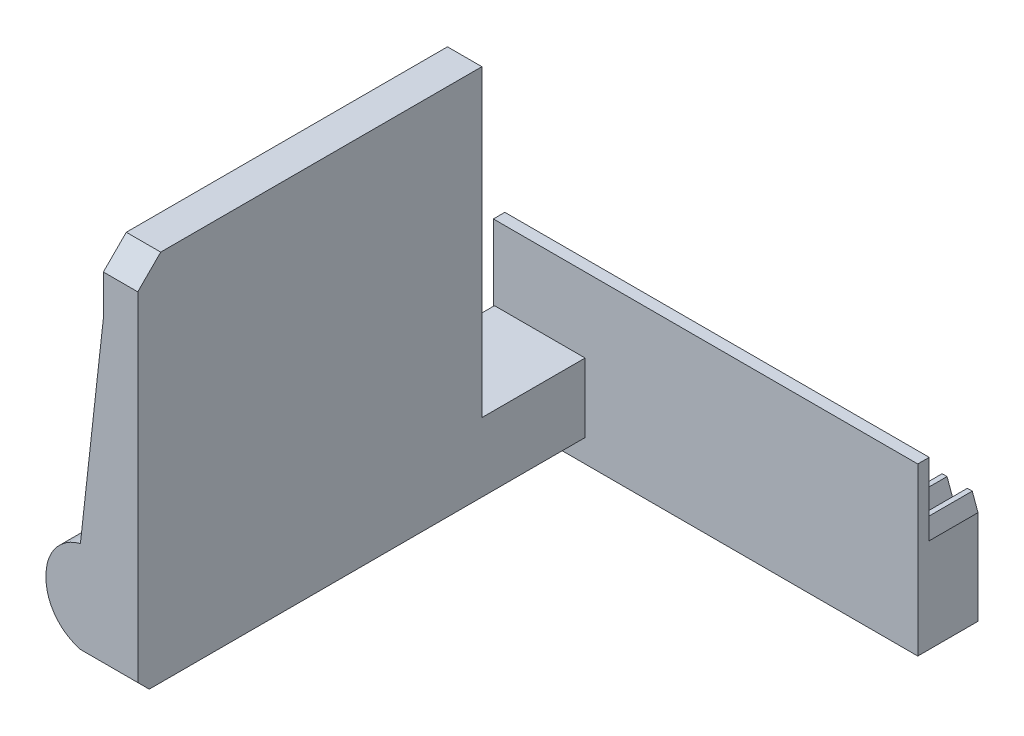
from build123d import *

# Parameters (mm, degrees)
SKETCH1_W           = 37
SKETCH1_H           = 8.005
SKETCH1_H_2         = 6.5
BOSS_EXTRUDE2_DEPTH = 1
BOSS_EXTRUDE3_DEPTH = 39
SKETCH3_W           = 9
SKETCH3_H           = 26.495
CUT_EXTRUDE1_DEPTH  = 65.214183639
SKETCH5_W           = 5
SKETCH5_H           = 5.5
CUT_EXTRUDE2_DEPTH  = 30
FILLET3_R           = 4
CHAMFER1_SIZE       = 2
SKETCH6_W           = 18.033887542
SKETCH6_H           = 50.935114565
CUT_EXTRUDE3_DEPTH  = 1


with BuildPart() as part:
    # <Rack>-<rack spur rectangular_am-5-solid1>: read off the stored shape, not the designer's step
    # <Rack>-<rack spur rectangular_am-5-solid1>: loft between two sections, ruled curve by curve
    rack_rack_spur_rectangular_am_5_solid1_from = [
        Edge.make_line((-44.536254126, 16.385147548, 25.848409668), (-44.964253225, 16.385147548, 25.848409668)),
        Edge.make_line((-46.735368981, 16.385147548, 25.848409668), (-47.16336808, 16.385147548, 25.848409668)),
        Edge.make_line((-48.934483836, 16.385147548, 25.848409668), (-49.362482935, 16.385147548, 25.848409668)),
        Edge.make_line((-51.133598691, 16.385147548, 25.848409668), (-51.56159779, 16.385147548, 25.848409668)),
        Edge.make_line((-53.332713546, 16.385147548, 25.848409668), (-53.760712645, 16.385147548, 25.848409668)),
        Edge.make_line((-55.531828401, 16.385147548, 25.848409668), (-55.9598275, 16.385147548, 25.848409668)),
        Edge.make_line((-57.730943256, 16.385147548, 25.848409668), (-58.158942355, 16.385147548, 25.848409668)),
        Edge.make_line((-59.930058111, 16.385147548, 25.848409668), (-60.35805721, 16.385147548, 25.848409668)),
        Edge.make_line((-62.129172966, 16.385147548, 25.848409668), (-62.557172065, 16.385147548, 25.848409668)),
        Edge.make_line((-64.328287821, 16.385147548, 25.848409668), (-64.75628692, 16.385147548, 25.848409668)),
        Edge.make_line((-66.527402676, 16.385147548, 25.848409668), (-66.955401775, 16.385147548, 25.848409668)),
        Edge.make_line((-68.726517531, 16.385147548, 25.848409668), (-69.15451663, 16.385147548, 25.848409668)),
        Edge.make_line((-70.925632386, 16.385147548, 25.848409668), (-71.353631485, 16.385147548, 25.848409668)),
        Edge.make_line((-73.124747241, 16.385147548, 25.848409668), (-73.55274634, 16.385147548, 25.848409668)),
        Edge.make_line((-75.323862096, 16.385147548, 25.848409668), (-75.751861195, 16.385147548, 25.848409668)),
        Edge.make_line((-77.522976951, 16.385147548, 25.848409668), (-77.95097605, 16.385147548, 25.848409668)),
        Edge.make_line((-78.836533928, 14.810147548, 25.848409668), (-78.836533928, 6.805147548, 25.848409668)),
        Edge.make_line((-42.337139271, 16.385147548, 25.848409668), (-42.76513837, 16.385147548, 25.848409668)),
        Edge.make_line((-41.836533928, 15.009745672, 25.848409668), (-41.836533928, 6.805147548, 25.848409668)),
        Edge.make_line((-78.836533928, 6.805147548, 25.848409668), (-41.836533928, 6.805147548, 25.848409668)),
        Edge.make_line((-77.95097605, 16.385147548, 25.848409668), (-78.524229169, 14.810147548, 25.848409668)),
        Edge.make_line((-78.836533928, 14.810147548, 25.848409668), (-78.524229169, 14.810147548, 25.848409668)),
        Edge.make_line((-77.522976951, 16.385147548, 25.848409668), (-76.949723832, 14.810147548, 25.848409668)),
        Edge.make_line((-75.751861195, 16.385147548, 25.848409668), (-76.325114314, 14.810147548, 25.848409668)),
        Edge.make_line((-76.949723832, 14.810147548, 25.848409668), (-76.325114314, 14.810147548, 25.848409668)),
        Edge.make_line((-75.323862096, 16.385147548, 25.848409668), (-74.750608977, 14.810147548, 25.848409668)),
        Edge.make_line((-73.55274634, 16.385147548, 25.848409668), (-74.125999459, 14.810147548, 25.848409668)),
        Edge.make_line((-74.750608977, 14.810147548, 25.848409668), (-74.125999459, 14.810147548, 25.848409668)),
        Edge.make_line((-73.124747241, 16.385147548, 25.848409668), (-72.551494122, 14.810147548, 25.848409668)),
        Edge.make_line((-71.353631485, 16.385147548, 25.848409668), (-71.926884604, 14.810147548, 25.848409668)),
        Edge.make_line((-72.551494122, 14.810147548, 25.848409668), (-71.926884604, 14.810147548, 25.848409668)),
        Edge.make_line((-70.925632386, 16.385147548, 25.848409668), (-70.352379267, 14.810147548, 25.848409668)),
        Edge.make_line((-69.15451663, 16.385147548, 25.848409668), (-69.727769749, 14.810147548, 25.848409668)),
        Edge.make_line((-70.352379267, 14.810147548, 25.848409668), (-69.727769749, 14.810147548, 25.848409668)),
        Edge.make_line((-68.726517531, 16.385147548, 25.848409668), (-68.153264412, 14.810147548, 25.848409668)),
        Edge.make_line((-66.955401775, 16.385147548, 25.848409668), (-67.528654894, 14.810147548, 25.848409668)),
        Edge.make_line((-68.153264412, 14.810147548, 25.848409668), (-67.528654894, 14.810147548, 25.848409668)),
        Edge.make_line((-66.527402676, 16.385147548, 25.848409668), (-65.954149557, 14.810147548, 25.848409668)),
        Edge.make_line((-64.75628692, 16.385147548, 25.848409668), (-65.329540039, 14.810147548, 25.848409668)),
        Edge.make_line((-65.954149557, 14.810147548, 25.848409668), (-65.329540039, 14.810147548, 25.848409668)),
        Edge.make_line((-64.328287821, 16.385147548, 25.848409668), (-63.755034702, 14.810147548, 25.848409668)),
        Edge.make_line((-62.557172065, 16.385147548, 25.848409668), (-63.130425184, 14.810147548, 25.848409668)),
        Edge.make_line((-63.755034702, 14.810147548, 25.848409668), (-63.130425184, 14.810147548, 25.848409668)),
        Edge.make_line((-62.129172966, 16.385147548, 25.848409668), (-61.555919847, 14.810147548, 25.848409668)),
        Edge.make_line((-60.35805721, 16.385147548, 25.848409668), (-60.931310329, 14.810147548, 25.848409668)),
        Edge.make_line((-61.555919847, 14.810147548, 25.848409668), (-60.931310329, 14.810147548, 25.848409668)),
        Edge.make_line((-59.930058111, 16.385147548, 25.848409668), (-59.356804992, 14.810147548, 25.848409668)),
        Edge.make_line((-58.158942355, 16.385147548, 25.848409668), (-58.732195474, 14.810147548, 25.848409668)),
        Edge.make_line((-59.356804992, 14.810147548, 25.848409668), (-58.732195474, 14.810147548, 25.848409668)),
        Edge.make_line((-57.730943256, 16.385147548, 25.848409668), (-57.157690137, 14.810147548, 25.848409668)),
        Edge.make_line((-55.9598275, 16.385147548, 25.848409668), (-56.533080619, 14.810147548, 25.848409668)),
        Edge.make_line((-57.157690137, 14.810147548, 25.848409668), (-56.533080619, 14.810147548, 25.848409668)),
        Edge.make_line((-55.531828401, 16.385147548, 25.848409668), (-54.958575282, 14.810147548, 25.848409668)),
        Edge.make_line((-53.760712645, 16.385147548, 25.848409668), (-54.333965764, 14.810147548, 25.848409668)),
        Edge.make_line((-54.958575282, 14.810147548, 25.848409668), (-54.333965764, 14.810147548, 25.848409668)),
        Edge.make_line((-53.332713546, 16.385147548, 25.848409668), (-52.759460427, 14.810147548, 25.848409668)),
        Edge.make_line((-51.56159779, 16.385147548, 25.848409668), (-52.134850909, 14.810147548, 25.848409668)),
        Edge.make_line((-52.759460427, 14.810147548, 25.848409668), (-52.134850909, 14.810147548, 25.848409668)),
        Edge.make_line((-51.133598691, 16.385147548, 25.848409668), (-50.560345572, 14.810147548, 25.848409668)),
        Edge.make_line((-49.362482935, 16.385147548, 25.848409668), (-49.935736054, 14.810147548, 25.848409668)),
        Edge.make_line((-50.560345572, 14.810147548, 25.848409668), (-49.935736054, 14.810147548, 25.848409668)),
        Edge.make_line((-48.934483836, 16.385147548, 25.848409668), (-48.361230717, 14.810147548, 25.848409668)),
        Edge.make_line((-47.16336808, 16.385147548, 25.848409668), (-47.736621199, 14.810147548, 25.848409668)),
        Edge.make_line((-48.361230717, 14.810147548, 25.848409668), (-47.736621199, 14.810147548, 25.848409668)),
        Edge.make_line((-46.735368981, 16.385147548, 25.848409668), (-46.162115862, 14.810147548, 25.848409668)),
        Edge.make_line((-44.964253225, 16.385147548, 25.848409668), (-45.537506344, 14.810147548, 25.848409668)),
        Edge.make_line((-46.162115862, 14.810147548, 25.848409668), (-45.537506344, 14.810147548, 25.848409668)),
        Edge.make_line((-44.536254126, 16.385147548, 25.848409668), (-43.963001007, 14.810147548, 25.848409668)),
        Edge.make_line((-42.76513837, 16.385147548, 25.848409668), (-43.338391489, 14.810147548, 25.848409668)),
        Edge.make_line((-43.963001007, 14.810147548, 25.848409668), (-43.338391489, 14.810147548, 25.848409668)),
        Edge.make_line((-42.337139271, 16.385147548, 25.848409668), (-41.836533928, 15.009745672, 25.848409668)),
    ]
    rack_rack_spur_rectangular_am_5_solid1_to = [
        Edge.make_line((-44.536254126, 16.385147548, 21.598409668), (-44.964253225, 16.385147548, 21.598409668)),
        Edge.make_line((-46.735368981, 16.385147548, 21.598409668), (-47.16336808, 16.385147548, 21.598409668)),
        Edge.make_line((-48.934483836, 16.385147548, 21.598409668), (-49.362482935, 16.385147548, 21.598409668)),
        Edge.make_line((-51.133598691, 16.385147548, 21.598409668), (-51.56159779, 16.385147548, 21.598409668)),
        Edge.make_line((-53.332713546, 16.385147548, 21.598409668), (-53.760712645, 16.385147548, 21.598409668)),
        Edge.make_line((-55.531828401, 16.385147548, 21.598409668), (-55.9598275, 16.385147548, 21.598409668)),
        Edge.make_line((-57.730943256, 16.385147548, 21.598409668), (-58.158942355, 16.385147548, 21.598409668)),
        Edge.make_line((-59.930058111, 16.385147548, 21.598409668), (-60.35805721, 16.385147548, 21.598409668)),
        Edge.make_line((-62.129172966, 16.385147548, 21.598409668), (-62.557172065, 16.385147548, 21.598409668)),
        Edge.make_line((-64.328287821, 16.385147548, 21.598409668), (-64.75628692, 16.385147548, 21.598409668)),
        Edge.make_line((-66.527402676, 16.385147548, 21.598409668), (-66.955401775, 16.385147548, 21.598409668)),
        Edge.make_line((-68.726517531, 16.385147548, 21.598409668), (-69.15451663, 16.385147548, 21.598409668)),
        Edge.make_line((-70.925632386, 16.385147548, 21.598409668), (-71.353631485, 16.385147548, 21.598409668)),
        Edge.make_line((-73.124747241, 16.385147548, 21.598409668), (-73.55274634, 16.385147548, 21.598409668)),
        Edge.make_line((-75.323862096, 16.385147548, 21.598409668), (-75.751861195, 16.385147548, 21.598409668)),
        Edge.make_line((-77.522976951, 16.385147548, 21.598409668), (-77.95097605, 16.385147548, 21.598409668)),
        Edge.make_line((-78.836533928, 14.810147548, 21.598409668), (-78.836533928, 6.805147548, 21.598409668)),
        Edge.make_line((-42.337139271, 16.385147548, 21.598409668), (-42.76513837, 16.385147548, 21.598409668)),
        Edge.make_line((-41.836533928, 15.009745672, 21.598409668), (-41.836533928, 6.805147548, 21.598409668)),
        Edge.make_line((-78.836533928, 6.805147548, 21.598409668), (-41.836533928, 6.805147548, 21.598409668)),
        Edge.make_line((-77.95097605, 16.385147548, 21.598409668), (-78.524229169, 14.810147548, 21.598409668)),
        Edge.make_line((-78.836533928, 14.810147548, 21.598409668), (-78.524229169, 14.810147548, 21.598409668)),
        Edge.make_line((-77.522976951, 16.385147548, 21.598409668), (-76.949723832, 14.810147548, 21.598409668)),
        Edge.make_line((-75.751861195, 16.385147548, 21.598409668), (-76.325114314, 14.810147548, 21.598409668)),
        Edge.make_line((-76.949723832, 14.810147548, 21.598409668), (-76.325114314, 14.810147548, 21.598409668)),
        Edge.make_line((-75.323862096, 16.385147548, 21.598409668), (-74.750608977, 14.810147548, 21.598409668)),
        Edge.make_line((-73.55274634, 16.385147548, 21.598409668), (-74.125999459, 14.810147548, 21.598409668)),
        Edge.make_line((-74.750608977, 14.810147548, 21.598409668), (-74.125999459, 14.810147548, 21.598409668)),
        Edge.make_line((-73.124747241, 16.385147548, 21.598409668), (-72.551494122, 14.810147548, 21.598409668)),
        Edge.make_line((-71.353631485, 16.385147548, 21.598409668), (-71.926884604, 14.810147548, 21.598409668)),
        Edge.make_line((-72.551494122, 14.810147548, 21.598409668), (-71.926884604, 14.810147548, 21.598409668)),
        Edge.make_line((-70.925632386, 16.385147548, 21.598409668), (-70.352379267, 14.810147548, 21.598409668)),
        Edge.make_line((-69.15451663, 16.385147548, 21.598409668), (-69.727769749, 14.810147548, 21.598409668)),
        Edge.make_line((-70.352379267, 14.810147548, 21.598409668), (-69.727769749, 14.810147548, 21.598409668)),
        Edge.make_line((-68.726517531, 16.385147548, 21.598409668), (-68.153264412, 14.810147548, 21.598409668)),
        Edge.make_line((-66.955401775, 16.385147548, 21.598409668), (-67.528654894, 14.810147548, 21.598409668)),
        Edge.make_line((-68.153264412, 14.810147548, 21.598409668), (-67.528654894, 14.810147548, 21.598409668)),
        Edge.make_line((-66.527402676, 16.385147548, 21.598409668), (-65.954149557, 14.810147548, 21.598409668)),
        Edge.make_line((-64.75628692, 16.385147548, 21.598409668), (-65.329540039, 14.810147548, 21.598409668)),
        Edge.make_line((-65.954149557, 14.810147548, 21.598409668), (-65.329540039, 14.810147548, 21.598409668)),
        Edge.make_line((-64.328287821, 16.385147548, 21.598409668), (-63.755034702, 14.810147548, 21.598409668)),
        Edge.make_line((-62.557172065, 16.385147548, 21.598409668), (-63.130425184, 14.810147548, 21.598409668)),
        Edge.make_line((-63.755034702, 14.810147548, 21.598409668), (-63.130425184, 14.810147548, 21.598409668)),
        Edge.make_line((-62.129172966, 16.385147548, 21.598409668), (-61.555919847, 14.810147548, 21.598409668)),
        Edge.make_line((-60.35805721, 16.385147548, 21.598409668), (-60.931310329, 14.810147548, 21.598409668)),
        Edge.make_line((-61.555919847, 14.810147548, 21.598409668), (-60.931310329, 14.810147548, 21.598409668)),
        Edge.make_line((-59.930058111, 16.385147548, 21.598409668), (-59.356804992, 14.810147548, 21.598409668)),
        Edge.make_line((-58.158942355, 16.385147548, 21.598409668), (-58.732195474, 14.810147548, 21.598409668)),
        Edge.make_line((-59.356804992, 14.810147548, 21.598409668), (-58.732195474, 14.810147548, 21.598409668)),
        Edge.make_line((-57.730943256, 16.385147548, 21.598409668), (-57.157690137, 14.810147548, 21.598409668)),
        Edge.make_line((-55.9598275, 16.385147548, 21.598409668), (-56.533080619, 14.810147548, 21.598409668)),
        Edge.make_line((-57.157690137, 14.810147548, 21.598409668), (-56.533080619, 14.810147548, 21.598409668)),
        Edge.make_line((-55.531828401, 16.385147548, 21.598409668), (-54.958575282, 14.810147548, 21.598409668)),
        Edge.make_line((-53.760712645, 16.385147548, 21.598409668), (-54.333965764, 14.810147548, 21.598409668)),
        Edge.make_line((-54.958575282, 14.810147548, 21.598409668), (-54.333965764, 14.810147548, 21.598409668)),
        Edge.make_line((-53.332713546, 16.385147548, 21.598409668), (-52.759460427, 14.810147548, 21.598409668)),
        Edge.make_line((-51.56159779, 16.385147548, 21.598409668), (-52.134850909, 14.810147548, 21.598409668)),
        Edge.make_line((-52.759460427, 14.810147548, 21.598409668), (-52.134850909, 14.810147548, 21.598409668)),
        Edge.make_line((-51.133598691, 16.385147548, 21.598409668), (-50.560345572, 14.810147548, 21.598409668)),
        Edge.make_line((-49.362482935, 16.385147548, 21.598409668), (-49.935736054, 14.810147548, 21.598409668)),
        Edge.make_line((-50.560345572, 14.810147548, 21.598409668), (-49.935736054, 14.810147548, 21.598409668)),
        Edge.make_line((-48.934483836, 16.385147548, 21.598409668), (-48.361230717, 14.810147548, 21.598409668)),
        Edge.make_line((-47.16336808, 16.385147548, 21.598409668), (-47.736621199, 14.810147548, 21.598409668)),
        Edge.make_line((-48.361230717, 14.810147548, 21.598409668), (-47.736621199, 14.810147548, 21.598409668)),
        Edge.make_line((-46.735368981, 16.385147548, 21.598409668), (-46.162115862, 14.810147548, 21.598409668)),
        Edge.make_line((-44.964253225, 16.385147548, 21.598409668), (-45.537506344, 14.810147548, 21.598409668)),
        Edge.make_line((-46.162115862, 14.810147548, 21.598409668), (-45.537506344, 14.810147548, 21.598409668)),
        Edge.make_line((-44.536254126, 16.385147548, 21.598409668), (-43.963001007, 14.810147548, 21.598409668)),
        Edge.make_line((-42.76513837, 16.385147548, 21.598409668), (-43.338391489, 14.810147548, 21.598409668)),
        Edge.make_line((-43.963001007, 14.810147548, 21.598409668), (-43.338391489, 14.810147548, 21.598409668)),
        Edge.make_line((-42.337139271, 16.385147548, 21.598409668), (-41.836533928, 15.009745672, 21.598409668)),
    ]
    rack_rack_spur_rectangular_am_5_solid1 = Solid(Shell([*[Face.make_surface_from_curves(rack_rack_spur_rectangular_am_5_solid1_from[k], rack_rack_spur_rectangular_am_5_solid1_to[k]) for k in range(71)], Face(Wire(rack_rack_spur_rectangular_am_5_solid1_from)), Face(Wire(rack_rack_spur_rectangular_am_5_solid1_to))]))
    add(rack_rack_spur_rectangular_am_5_solid1)


with BuildPart() as part_1:
    # Rack: read off the stored shape, not the designer's step
    # Rack: moved
    add(part.part.moved(Location((57.6763086, -7.3277822, -25.8484097))))

    # Sketch1 → Boss-Extrude2 (add)
    with BuildSketch(Plane.XY):
        with Locations((-2.66022528, 3.47986538)):
            Rectangle(SKETCH1_W, SKETCH1_H)
        with Locations((-2.66022528, 10.73236538)):
            Rectangle(SKETCH1_W, SKETCH1_H_2)
    extrude(amount=BOSS_EXTRUDE2_DEPTH)

    # Sketch2 → Boss-Extrude3 (add)
    with BuildSketch(Plane.XY.offset(1)):
        Polygon((-21.16022528, 33.97736538), (-21.16022528, 2.47736538), (-18.16022528, 2.47736538), (-18.16022528, 0.47736538), (-13.16022528, 0.47736538), (-13.16022528, 33.97736538), align=None)
    extrude(amount=BOSS_EXTRUDE3_DEPTH)

    # Sketch3 → Cut-Extrude1 (cut, through all)
    with BuildSketch(Plane.ZY.offset(21.16022528)):
        with Locations((5.5, 20.72986538)):
            Rectangle(SKETCH3_W, SKETCH3_H)
    extrude(amount=-CUT_EXTRUDE1_DEPTH, mode=Mode.SUBTRACT)

    # Sketch5 → Cut-Extrude2 (cut)
    with BuildSketch(Plane.XY.offset(40)):
        with Locations((-18.66022528, 31.22736538)):
            Rectangle(SKETCH5_W, SKETCH5_H)
        Polygon((-21.16022528, 28.47736538), (-21.16022528, 10.47736538), (-18.16022528, 10.47736538), (-16.16022528, 28.47736538), align=None)
    extrude(amount=-CUT_EXTRUDE2_DEPTH, mode=Mode.SUBTRACT)

    # Fillet3
    # the kernel refuses this fillet: 4 mm, written as the material it takes off along each edge
    with BuildSketch(Plane(origin=(-21.16022528, 2.47736538, 1), x_dir=(0, 1, 0), z_dir=(0, 0, 1))) as fillet3_piece_1:
        with BuildLine():
            CenterArc((3.872983346, -4), FILLET3_R, 90, 75.522487814)
            Line((0, -3), (0, 0))
            Line((0, 0), (3.872983346, 0))
        make_face()
    extrude(amount=48.682458366, mode=Mode.SUBTRACT)
    with BuildSketch(Plane(origin=(-21.16022528, 10.47736538, 49.682458366), x_dir=(0, -1, 0), z_dir=(0, 0, -1))) as fillet3_piece_2_section:
        with BuildLine():
            CenterArc((3.872983346, -4), FILLET3_R, 90, 75.522487814)
            Line((0, -3), (0, 0))
            Line((0, 0), (3.872983346, 0))
        make_face()
    fillet3_piece_2 = extrude(amount=49.364916731, mode=Mode.PRIVATE)
    fillet3_piece_2 = split(fillet3_piece_2, bisect_by=Plane(origin=(-21.16022528, 10.47736538, 1), z_dir=(0, 0, 1)), keep=Keep.TOP, mode=Mode.PRIVATE)
    add(fillet3_piece_2, mode=Mode.SUBTRACT)

    # Chamfer1
    chamfer1_edges = [part_1.edges().sort_by_distance(p)[0] for p in [
        (-15.66022528, 0.47736538, 40),
        (-14.66022528, 33.97736538, 40),
    ]]
    chamfer(chamfer1_edges, length=CHAMFER1_SIZE)

    # Sketch6 → Cut-Extrude3 (cut)
    with BuildSketch(Plane.XZ.offset(-0.47736538)):
        with Locations((-16.99836785, 26.467557283)):
            Rectangle(SKETCH6_W, SKETCH6_H)
    extrude(amount=-CUT_EXTRUDE3_DEPTH, mode=Mode.SUBTRACT)


solid = part_1.part
